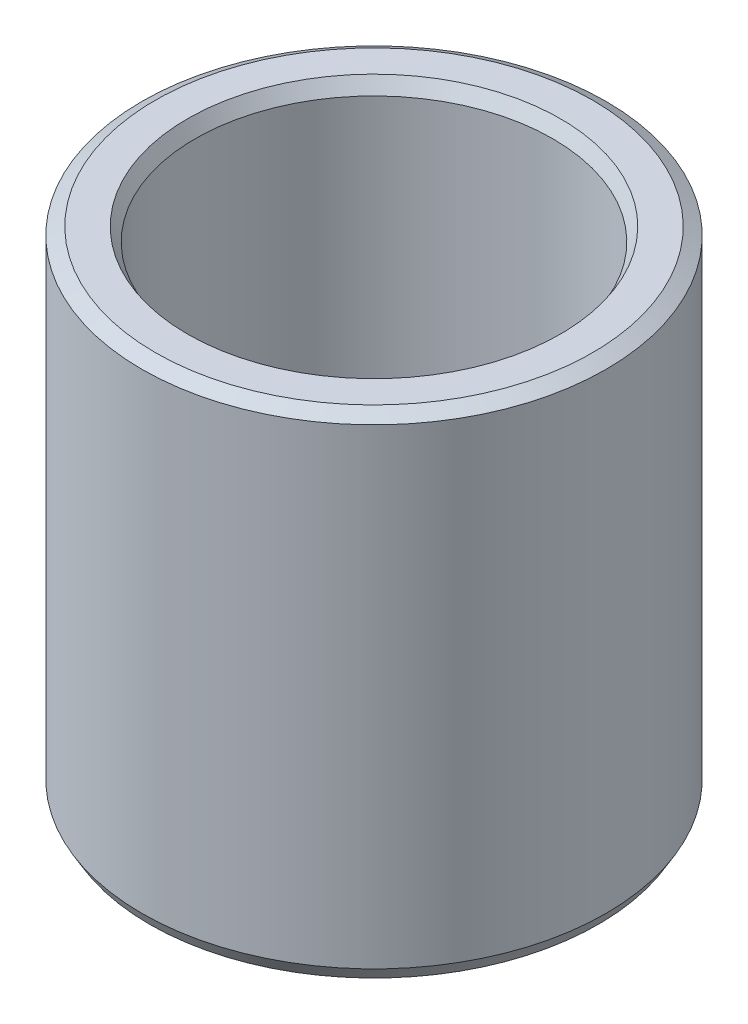
from build123d import *
from OCP.BRepFilletAPI import BRepFilletAPI_MakeChamfer

# Parameters (mm, degrees)
SKETCH1_R           = 35
BOSS_EXTRUDE1_DEPTH = 74.250262564
SKETCH2_R           = 26.962227531
CUT_EXTRUDE1_DEPTH  = 90.236211768
CHAMFER1_SIZE       = 1.16794535
CHAMFER1_SIZE2      = 2.022940686


with BuildPart() as part:
    # Sketch1 → Boss-Extrude1 (new body)
    with BuildSketch(Plane(origin=(0, 0, 0), x_dir=(1, 0, 0), z_dir=(0, 1, 0))):
        Circle(SKETCH1_R)
    extrude(amount=BOSS_EXTRUDE1_DEPTH)

    # Sketch2 → Cut-Extrude1 (cut, through all)
    with BuildSketch(Plane(origin=(0, 0, 0), x_dir=(1, 0, 0), z_dir=(0, 1, 0))):
        Circle(SKETCH2_R)
    extrude(amount=CUT_EXTRUDE1_DEPTH, mode=Mode.SUBTRACT)

    # Chamfer1: one chamfer whose edges measure the first distance from different faces: ONE call of the kernel's chamfer builder (chamfer() names one face for all edges)
    chamfer1_edges_1 = [part.edges().sort_by_distance(p)[0] for p in [
        (-26.962227531, 74.250262564, 0),
    ]]
    chamfer1_side_1 = [part.faces().sort_by_distance(p)[0] for p in [
        (-34.010050506, 74.250262564, 0),
    ]]
    chamfer1_edges_2 = [part.edges().sort_by_distance(p)[0] for p in [
        (-26.962227531, 0, 0),
    ]]
    chamfer1_side_2 = [part.faces().sort_by_distance(p)[0] for p in [
        (-26.962227531, 37.125131282, 0),
    ]]
    chamfer1_edges_3 = [part.edges().sort_by_distance(p)[0] for p in [
        (-35, 0, 0),
    ]]
    chamfer1_side_3 = [part.faces().sort_by_distance(p)[0] for p in [
        (-34.010050506, 0, 0),
    ]]
    chamfer1_edges_4 = [part.edges().sort_by_distance(p)[0] for p in [
        (-35, 74.250262564, 0),
    ]]
    chamfer1_side_4 = [part.faces().sort_by_distance(p)[0] for p in [
        (-35, 37.125131282, 0),
    ]]
    chamfer1 = BRepFilletAPI_MakeChamfer(part.part.solid().wrapped)
    for e in chamfer1_edges_1:
        chamfer1.Add(CHAMFER1_SIZE, CHAMFER1_SIZE2, e.wrapped, chamfer1_side_1[0].wrapped)  # the first distance lies on this face
    for e in chamfer1_edges_2:
        chamfer1.Add(CHAMFER1_SIZE, CHAMFER1_SIZE2, e.wrapped, chamfer1_side_2[0].wrapped)  # the first distance lies on this face
    for e in chamfer1_edges_3:
        chamfer1.Add(CHAMFER1_SIZE, CHAMFER1_SIZE2, e.wrapped, chamfer1_side_3[0].wrapped)  # the first distance lies on this face
    for e in chamfer1_edges_4:
        chamfer1.Add(CHAMFER1_SIZE, CHAMFER1_SIZE2, e.wrapped, chamfer1_side_4[0].wrapped)  # the first distance lies on this face
    add(Compound.cast(chamfer1.Shape()), mode=Mode.REPLACE)


solid = part.part
